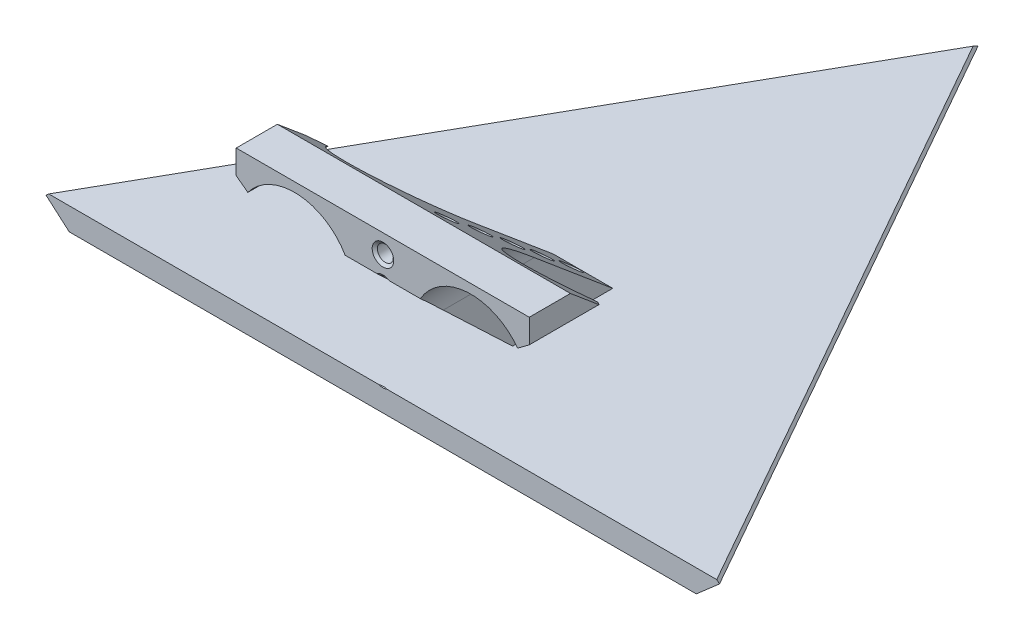
from build123d import *

# Parameters (mm, degrees)
BOSS_EXTRUDE1_DEPTH                       = 7.65
BOSS_EXTRUDE2_DEPTH                       = 5.08
CHAMFER1_SIZE                             = 1
CHAMFER2_SIZE                             = 1
CHAMFER3_SIZE                             = 5
CHAMFER4_SIZE                             = 5
BOSS_EXTRUDE3_DEPTH                       = 30
CUT_EXTRUDE1_DEPTH                        = 45.08
CUT_EXTRUDE3_DEPTH                        = 45.08
CUT_EXTRUDE4_DEPTH                        = 118.13273671
CUT_EXTRUDE4_DEPTH_BACK                   = 118.13273671
F_9_64_0_14063_DIAMETER_HOLE1_D           = 3.572002
F_9_64_0_14063_DIAMETER_HOLE1_CSINK_D     = 4.842002
F_9_64_0_14063_DIAMETER_HOLE1_CSINK_ANGLE = 100
CUT_EXTRUDE5_DEPTH                        = 118.132626096
CUT_EXTRUDE5_DEPTH_BACK                   = 118.132626096


with BuildPart() as part:
    # Sketch2 → Boss-Extrude1 (new body)
    with BuildSketch(Plane.XY):
        Polygon((-7.97490293, 0.58645445), (-7.97490293, -10.885302369), (-1.942800482, -10.885302369), (-1.942800482, -9.089251145), (-5.53490293, -5.497148696), (-5.53490293, -0.387148696), (-5.53490293, -0.287148696), (5.441404415, -0.287148696), (5.441404415, -0.387148696), (5.441404415, -5.497148696), (1.849301966, -9.089251145), (1.849301966, -10.885302369), (7.881404415, -10.885302369), (7.881404415, 0.58645445), align=None)
    extrude(amount=BOSS_EXTRUDE1_DEPTH)

    # Sketch3 → Boss-Extrude2 (add)
    with BuildSketch(Plane(origin=(0, 0.58645445, 0), x_dir=(1, 0, 0), z_dir=(0, 1, 0))):
        Polygon((-0.046749258, -58.45), (76.153250742, -58.45), (0, 76.2), (-76.246749258, -58.45), align=None)
    extrude(amount=BOSS_EXTRUDE2_DEPTH)

    # Chamfer1
    chamfer1_edges = [part.edges().sort_by_distance(p)[0] for p in [
        (38.076625371, 5.66645445, -8.875),
    ]]
    chamfer(chamfer1_edges, length=CHAMFER1_SIZE)

    # Chamfer2
    chamfer2_edges = [part.edges().sort_by_distance(p)[0] for p in [
        (-38.410764077, 5.66645445, -8.367476866),
    ]]
    chamfer(chamfer2_edges, length=CHAMFER2_SIZE)

    # Chamfer3
    # the kernel refuses this chamfer: 5 mm, written as the material it takes off along each edge
    with BuildSketch(Plane(origin=(6.335905635, 0.58645445, -87.389063167), x_dir=(-0.023926207208635007, 0.9996219169112968, -0.013548425709062981), z_dir=(-0.49274390851198024, 0, 0.8701743736885943))) as chamfer3_piece_1:
        Polygon((CHAMFER3_SIZE * 0.999621916911, -CHAMFER3_SIZE * 0.0274958766106), (-CHAMFER3_SIZE * 0.0274958766106, -CHAMFER3_SIZE * 0.999621916911), (0, 0), align=None)
    extrude(amount=180.455930537, mode=Mode.SUBTRACT)

    # Chamfer4
    # the kernel refuses this chamfer: 5 mm, written as the material it takes off along each edge
    with BuildSketch(Plane(origin=(82.483270671, 0.58645445, 69.642393956), x_dir=(-0.8701043132999969, -0.02749587661058631, 0.49210005156081454), z_dir=(-0.49228617663900415, 0, -0.870433409451953))) as chamfer4_piece_1:
        Polygon((CHAMFER4_SIZE * 0.999621916911, CHAMFER4_SIZE * 0.0274958766106), (-CHAMFER4_SIZE * 0.0274958766106, CHAMFER4_SIZE * 0.999621916911), (0, 0), align=None)
    extrude(amount=174.577450859, mode=Mode.SUBTRACT)

    # Sketch4 → Boss-Extrude3 (add)
    with BuildSketch(Plane(origin=(0, 5.66645445, 0), x_dir=(1, 0, 0), z_dir=(0, 1, 0))):
        Polygon((-7.97490293, -13.45), (7.881404415, -13.45), (32.881404415, -13.45), (32.881404415, -58.45), (7.881404415, -58.45), (-7.97490293, -58.45), (-32.97490293, -58.45), (-32.97490293, -13.45), align=None)
    extrude(amount=BOSS_EXTRUDE3_DEPTH)

    # Sketch5 → Cut-Extrude1 (cut)
    with BuildSketch(Plane(origin=(0, 0, 13.45), x_dir=(-1, 0, 0), z_dir=(0, 0, -1))):
        Polygon((-6.640745102, 5.66645445), (-32.881404415, 5.66645445), (-32.881404415, 30.285655528), (-6.640745102, 10.66645445), align=None)
        Polygon((6.734243618, 10.66645445), (6.734243618, 5.66645445), (32.97490293, 5.66645445), (32.97490293, 30.285655528), align=None)
    extrude(amount=-CUT_EXTRUDE1_DEPTH, mode=Mode.SUBTRACT)

    # Sketch7 → Cut-Extrude3 (cut)
    with BuildSketch(Plane(origin=(0, 0, 13.45), x_dir=(-1, 0, 0), z_dir=(0, 0, -1))):
        with BuildLine():
            Line((-6.640745102, 20.476054989), (-6.640745102, 10.66645445))
            Line((-6.640745102, 10.66645445), (-11.048165512, 10.66645445))
            ThreePointArc((-11.048165512, 10.66645445), (-31.728933629, 25.853173581), (-6.640745102, 20.476054989))
        make_face()
        with BuildLine():
            Line((6.734243618, 20.476054989), (6.734243618, 10.66645445))
            Line((6.734243618, 10.66645445), (11.141664027, 10.66645445))
            ThreePointArc((11.141664027, 10.66645445), (31.822432144, 25.853173581), (6.734243618, 20.476054989))
        make_face()
    extrude(amount=-CUT_EXTRUDE3_DEPTH, mode=Mode.SUBTRACT)

    # Sketch9 → Cut-Extrude4 (cut, two sides: drawn at the far end of the back side and taken through both)
    with BuildSketch(Plane.ZY.offset(6.734243618).offset(-CUT_EXTRUDE4_DEPTH_BACK)):
        Polygon((13.45, 5.66645445), (49.202607778, 35.66645445), (13.45, 35.66645445), align=None)
    extrude(amount=CUT_EXTRUDE4_DEPTH + CUT_EXTRUDE4_DEPTH_BACK, mode=Mode.SUBTRACT)

    # 9/64 (0.14063) Diameter Hole1 (through all)
    with Locations(Plane.XY.offset(58.45)):
        with Locations((0, 31.40818219), (0, 25.046150321), (0, 18.994461471), (0, 13.408287148), (0, 7.899698579)):
            CounterSinkHole(F_9_64_0_14063_DIAMETER_HOLE1_D / 2, F_9_64_0_14063_DIAMETER_HOLE1_CSINK_D / 2, counter_sink_angle=F_9_64_0_14063_DIAMETER_HOLE1_CSINK_ANGLE)

    # Sketch13 → Cut-Extrude5 (cut, two sides: drawn at the far end of the back side and taken through both)
    with BuildSketch(Plane(origin=(6.640745102, 0, 0), x_dir=(0, 0, -1), z_dir=(1, 0, 0)).offset(-CUT_EXTRUDE5_DEPTH_BACK)):
        Polygon((-58.45, 27.036219817), (-35.95, 5.66645445), (-58.45, 5.66645445), align=None)
    extrude(amount=CUT_EXTRUDE5_DEPTH + CUT_EXTRUDE5_DEPTH_BACK, mode=Mode.SUBTRACT)


solid = part.part
